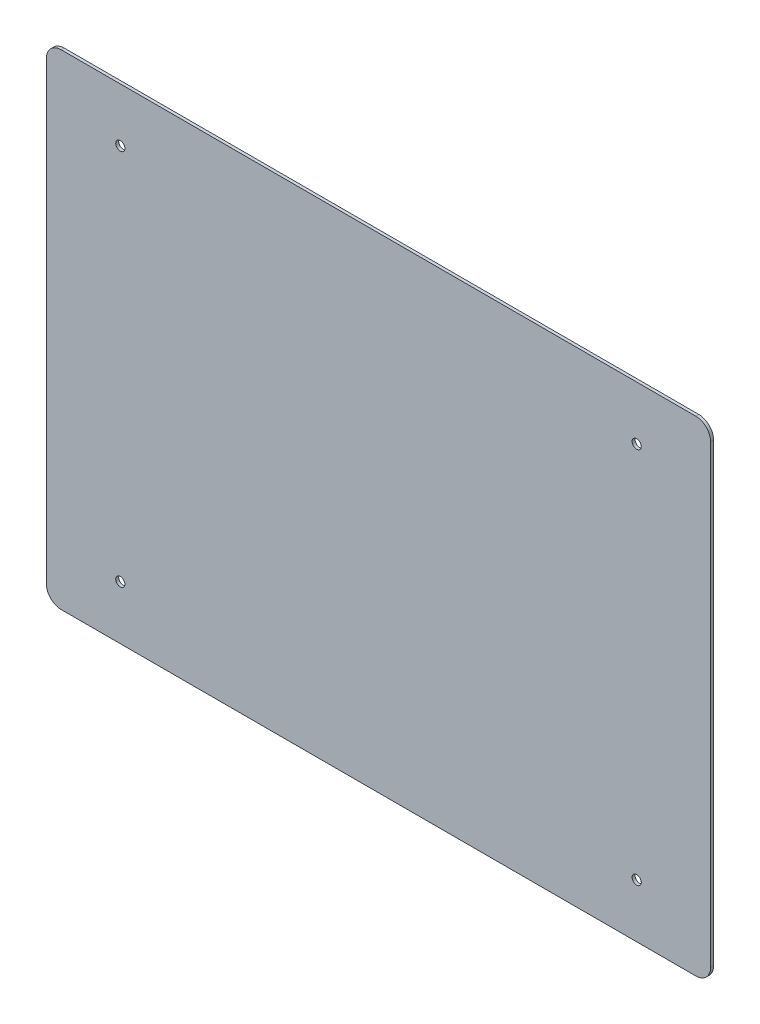
from build123d import *

# Parameters (mm, degrees)
SKETCH2_W               = 450.48
SKETCH2_H               = 328.82
BOSS_EXTRUDE1_DEPTH     = 2.032
CUT_EXTRUDE1_DEPTH      = 279.868848608
CUT_EXTRUDE1_DEPTH_BACK = 279.868848608
SKETCH3_R               = 3.1
FILLET1_R               = 10


with BuildPart() as part:
    # Sketch2 → Boss-Extrude1 (new body)
    with BuildSketch(Plane.XY):
        Rectangle(SKETCH2_W, SKETCH2_H)
    extrude(amount=BOSS_EXTRUDE1_DEPTH)

    # Sketch3 → Cut-Extrude1 (cut, two sides: drawn at the far end of the back side and taken through both)
    with BuildSketch(Plane.XY.offset(2.032).offset(-CUT_EXTRUDE1_DEPTH_BACK)):
        with Locations((-175.117048267, 128.010047732)):
            Circle(SKETCH3_R)
        with Locations((175.116951733, 128.010047732)):
            Circle(SKETCH3_R)
        with Locations((-175.117051477, -128.009951732)):
            Circle(SKETCH3_R)
        with Locations((175.116948523, -128.009951732)):
            Circle(SKETCH3_R)
    extrude(amount=CUT_EXTRUDE1_DEPTH + CUT_EXTRUDE1_DEPTH_BACK, mode=Mode.SUBTRACT)

    # Fillet1
    fillet1_edges = [part.edges().sort_by_distance(p)[0] for p in [
        (-225.24, -164.41, 1.016),
        (225.24, -164.41, 1.016),
        (225.24, 164.41, 1.016),
        (-225.24, 164.41, 1.016),
    ]]
    fillet(fillet1_edges, radius=FILLET1_R)


solid = part.part
